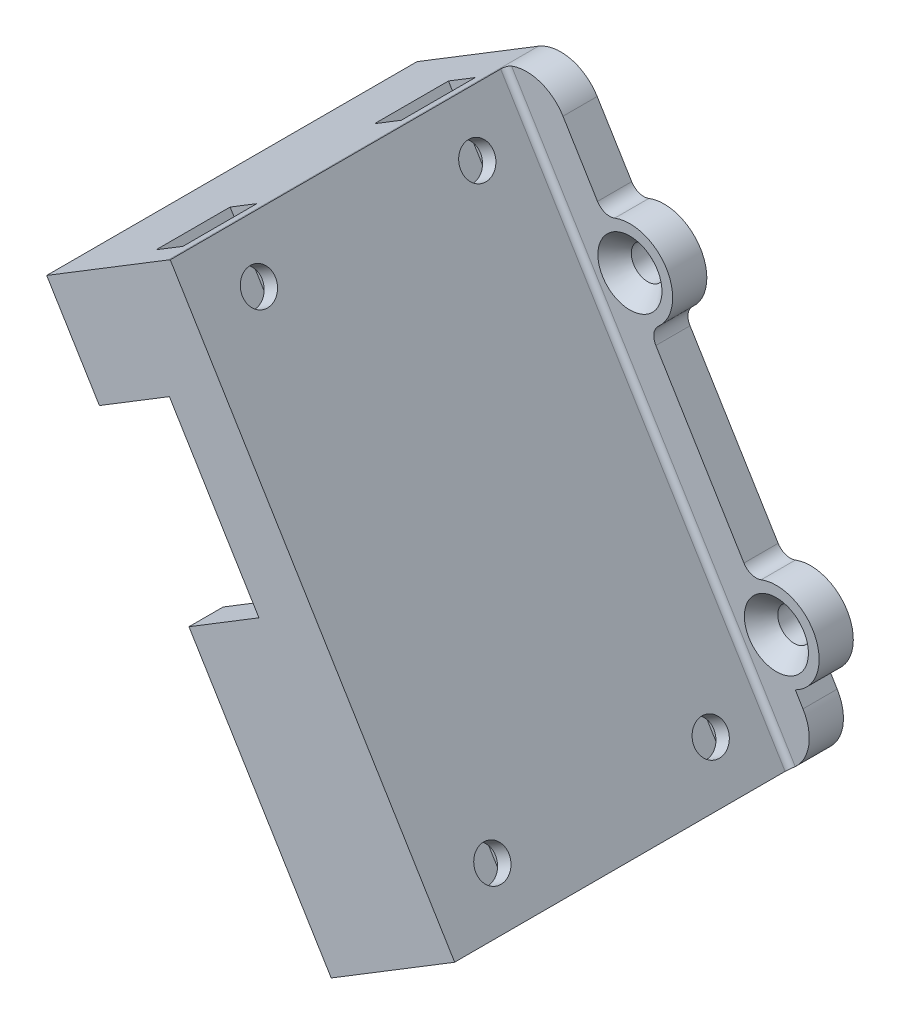
from build123d import *

# Parameters (mm, degrees)
BOSS_EXTRUDE1_DEPTH                               = 3.048
BOSS_EXTRUDE2_DEPTH                               = 29.971999999999998
BOSS_EXTRUDE3_DEPTH                               = 3.048
BOSS_EXTRUDE4_DEPTH                               = 3.048
SKETCH13_W                                        = 29.972
SKETCH13_H                                        = 48.7
BOSS_EXTRUDE5_DEPTH                               = 3.048
CSK_FOR_4_FLAT_HEAD_MACHINE_SCREW_100_D           = 2.9464
CSK_FOR_4_FLAT_HEAD_MACHINE_SCREW_100_CSINK_D     = 5.715
CSK_FOR_4_FLAT_HEAD_MACHINE_SCREW_100_CSINK_ANGLE = 100
CUT_EXTRUDE1_DEPTH                                = 1.397
CUT_EXTRUDE1_DEPTH_BACK                           = 1.397
SKETCH15_R                                        = 9.184035329670005
SKETCH15_R_2                                      = 8.124741076595411
SKETCH15_R_3                                      = 8.201451240556812
SKETCH15_R_4                                      = 5.810172256980604
BOSS_EXTRUDE6_DEPTH                               = 3.048
CSK_FOR_4_FLAT_HEAD_MACHINE_SCREW1_AT_2_COUNT     = 2
CSK_FOR_4_FLAT_HEAD_MACHINE_SCREW1_AT_2_PITCH     = 35.474094707842795
CSK_FOR_4_FLAT_HEAD_MACHINE_SCREW1_AT_3_COUNT     = 2
CSK_FOR_4_FLAT_HEAD_MACHINE_SCREW1_AT_3_PITCH     = 43.70753982500484
CSK_FOR_4_FLAT_HEAD_MACHINE_SCREW1_AT_4_COUNT     = 2
CSK_FOR_4_FLAT_HEAD_MACHINE_SCREW1_AT_4_PITCH     = 25.069264350610375
CUT_EXTRUDE2_DEPTH                                = 3.048
FILLET3_R                                         = 3.8099999999999996
FILLET4_R                                         = 1.27
SKETCH21_W                                        = 2.540000000000001
SKETCH21_H                                        = 33.02
CUT_EXTRUDE3_DEPTH                                = 77.47
FILLET5_R                                         = 0.508
FILLET6_R                                         = 0.508
SKETCH22_W                                        = 123.04970813102194
SKETCH22_H                                        = 134.7131875745612
CUT_EXTRUDE4_DEPTH                                = 77.47


with BuildPart() as part:
    # Sketch2 → Boss-Extrude1 (new body)
    with BuildSketch(Plane.XY):
        Polygon((-47.58059551455695, 48.12489153745831), (-22.21147896413696, 6.554494312375088), (5.701292889255674, 23.58878817682547), (-19.667823661164306, 65.1591854019087), align=None)
        Polygon((-38.85234269167306, 46.0124042215628), (-20.098991648241444, 15.282747135258976), (-3.0269599336282123, 25.701275492720985), (-21.78031097705982, 56.430932579024805), align=None, mode=Mode.SUBTRACT)
    extrude(amount=BOSS_EXTRUDE1_DEPTH)

    # Sketch3 → Boss-Extrude2 (add)
    with BuildSketch(Plane.XY.offset(3.048)):
        Polygon((2.4490708476218597, 21.604058524728963), (-22.920045702798127, 63.17445574981219), (-44.328373472923126, 50.10962118955482), (-18.95925692250314, 8.539223964471608), align=None)
        Polygon((-38.85234269167306, 46.0124042215628), (-20.098991648241444, 15.282747135258976), (-3.0269599336282087, 25.701275492720985), (-21.78031097705982, 56.430932579024805), align=None, mode=Mode.SUBTRACT)
    extrude(amount=BOSS_EXTRUDE2_DEPTH)

    # Sketch4 → Boss-Extrude3 (add)
    with BuildSketch(Plane.XY.offset(33.02)):
        Polygon((-38.85234269167306, 46.0124042215628), (-37.46131723814535, 43.733039051773666), (-20.389285523532113, 54.15156740923567), (-21.78031097705982, 56.430932579024805), align=None)
        Polygon((-29.47566716995725, 30.647575678410885), (-12.403635455344016, 41.0661040358729), (-3.0269599336282087, 25.701275492720985), (-20.098991648241444, 15.282747135258976), align=None)
    extrude(amount=-BOSS_EXTRUDE3_DEPTH)

    # Sketch12 → Boss-Extrude4 (add)
    with BuildSketch(Plane.XY.offset(3.048)):
        Polygon((2.4490708476218597, 21.604058524728963), (5.701292889255674, 23.58878817682547), (8.120429940678708, 25.065112049236276), (-17.248686609741274, 66.6355092743195), (-22.920045702798127, 63.17445574981219), align=None)
    extrude(amount=-BOSS_EXTRUDE4_DEPTH)

    # Sketch13 → Boss-Extrude5 (add)
    with BuildSketch(Plane(origin=(11.391019162328917, 6.95158362794815, 0), x_dir=(0, 0, -1), z_dir=(0.8536015857306615, 0.5209264178731006, 0))):
        with Locations((-18.034000000000002, 41.515472911157566)):
            Rectangle(SKETCH13_W, SKETCH13_H)
    extrude(amount=BOSS_EXTRUDE5_DEPTH)

    # CSK for #4 Flat Head Machine Screw (100)2 (through all)
    with Locations(Plane(origin=(-10.017308607796087, -6.113250932309213, 0), x_dir=(0, 0, 1), z_dir=(-0.8536015857306615, -0.5209264178731007, 0))):
        with Locations((27.397617355, 61.471448289), (7.925915452, 61.471448289), (7.925915452, 21.515515982), (27.397617355, 21.515515982)):
            CounterSinkHole(CSK_FOR_4_FLAT_HEAD_MACHINE_SCREW_100_D / 2, CSK_FOR_4_FLAT_HEAD_MACHINE_SCREW_100_CSINK_D / 2, counter_sink_angle=CSK_FOR_4_FLAT_HEAD_MACHINE_SCREW_100_CSINK_ANGLE)

    # Sketch14 → Cut-Extrude1 (cut, two sides: drawn at the far end of the back side and taken through both)
    with BuildSketch(Plane(origin=(11.607833965104508, 7.083898938087922, 0), x_dir=(0, 0, -1), z_dir=(0.8536015857306615, 0.5209264178731005, 0)).offset(-CUT_EXTRUDE1_DEPTH_BACK)):
        Polygon((-30.697174143874744, 19.61051598216394), (-30.697174143874744, 14.979833054183299), (-24.09806056703731, 14.979833054183299), (-24.09806056703731, 19.610515982163985), (-24.098060567037347, 23.42051598216399), (-27.39761735545604, 25.325515982163957), (-30.697174143874758, 23.420515982163952), align=None)
        Polygon((-27.39761735545604, 57.661448288693826), (-24.098060567037333, 59.56644828869383), (-24.098060567037336, 63.37644828869381), (-24.098060567037336, 70.99644828869384), (-30.69717414387474, 70.99644828869384), (-30.69717414387474, 63.37644828869381), (-30.69717414387474, 59.56644828869381), align=None)
        Polygon((-7.925915451689084, 57.661448288693826), (-4.626358663270381, 59.56644828869382), (-4.626358663270402, 63.37644828869381), (-4.626358663270402, 70.99644828869384), (-11.225472240107786, 70.99644828869384), (-11.225472240107786, 63.376448288693766), (-11.225472240107747, 59.566448288693785), align=None)
        Polygon((-7.925915451689081, 25.325515982163946), (-11.225472240107791, 23.42051598216395), (-11.225472240107791, 19.610515982163946), (-11.225472240107791, 14.979833054183299), (-4.626358663270366, 14.979833054183299), (-4.626358663270366, 19.610515982163953), (-4.6263586632703655, 23.420515982163952), align=None)
    extrude(amount=CUT_EXTRUDE1_DEPTH + CUT_EXTRUDE1_DEPTH_BACK, mode=Mode.SUBTRACT)

    # Sketch15 → Boss-Extrude6 (add)
    with BuildSketch(Plane(origin=(0, 0, 0), x_dir=(-1, 0, 0), z_dir=(0, 0, -1))):
        with Locations((9.758086495919196, 54.36124573948299)):
            Circle(SKETCH15_R)
        with Locations((39.927818301519274, 35.58488100974543)):
            Circle(SKETCH15_R_2)
        with Locations((25.610425726235285, 18.04643091882164)):
            Circle(SKETCH15_R_3)
        with Locations((-3.4576236647063787, 32.70568986323082)):
            Circle(SKETCH15_R_4)
    extrude(amount=-BOSS_EXTRUDE6_DEPTH)

    # Sketch19 → CSK for #4 Flat Head Machine Screw1 (revolve, cut)
    with BuildSketch(Plane(origin=(3.764373982237945, 32.86032278852424, 3.048), x_dir=(0, -1, 0), z_dir=(1, 0, 0))):
        Polygon((0, 0), (-7.5e-16, 3.0480000000000023), (1.4731999999999932, 3.0480000000000023), (1.4731999999999934, 1.59245498611605), (2.857499999999999, -1.73e-15), align=None)
    csk_for_4_flat_head_machine_screw1 = revolve(axis=Axis((3.764373982237945, 32.86032278852424, 9.39799999999999), (0, 0, -1)), mode=Mode.SUBTRACT)

    # CSK for #4 Flat Head Machine Screw1 at 2: CSK for #4 Flat Head Machine Screw1 ×2
    with Locations(*[Vector(-0.8506492202713736, -0.5257336816789507, 0) * (i * CSK_FOR_4_FLAT_HEAD_MACHINE_SCREW1_AT_2_PITCH) for i in range(1, CSK_FOR_4_FLAT_HEAD_MACHINE_SCREW1_AT_2_COUNT)]):
        add(csk_for_4_flat_head_machine_screw1, mode=Mode.SUBTRACT)

    # CSK for #4 Flat Head Machine Screw1 at 3: CSK for #4 Flat Head Machine Screw1 ×2
    with Locations(*[Vector(-0.997755305773639, 0.06696528802709796, 0) * (i * CSK_FOR_4_FLAT_HEAD_MACHINE_SCREW1_AT_3_PITCH) for i in range(1, CSK_FOR_4_FLAT_HEAD_MACHINE_SCREW1_AT_3_COUNT)]):
        add(csk_for_4_flat_head_machine_screw1, mode=Mode.SUBTRACT)

    # CSK for #4 Flat Head Machine Screw1 at 4: CSK for #4 Flat Head Machine Screw1 ×2
    with Locations(*[Vector(-0.5210117203175807, 0.8535495224600124, 0) * (i * CSK_FOR_4_FLAT_HEAD_MACHINE_SCREW1_AT_4_PITCH) for i in range(1, CSK_FOR_4_FLAT_HEAD_MACHINE_SCREW1_AT_4_COUNT)]):
        add(csk_for_4_flat_head_machine_screw1, mode=Mode.SUBTRACT)

    # Sketch20 → Cut-Extrude2 (cut)
    with BuildSketch(Plane(origin=(0, 0, 0), x_dir=(-1, 0, 0), z_dir=(0, 0, -1))):
        with BuildLine():
            Line((14.542293121824187, 62.20075286029573), (11.563953125478477, 57.32037886408755))
            ThreePointArc((11.563953125478477, 57.32037886408755), (6.044784522535942, 56.24291105550805), (7.610320649443919, 50.84186897257834))
            Line((7.610320649443919, 50.84186897257834), (-1.4954062126549716, 35.92102291440944))
            ThreePointArc((-1.4954062126549716, 35.92102291440944), (-7.016596023871767, 34.845052440620755), (-5.448804035753348, 29.442897530407524))
            Line((-5.448804035753348, 29.442897530407524), (-6.484295885760952, 27.746117611303884))
            Line((-6.484295885760952, 27.746117611303884), (-6.762670750549963, 27.28996638176623))
            Line((-6.762670750549963, 27.28996638176623), (-14.061950278269341, 31.74448896114331))
            Line((-14.061950278269341, 31.74448896114331), (8.559037851416688, 68.81174198534737))
            Line((8.559037851416688, 68.81174198534737), (14.542293121824187, 65.16034795406075))
            Line((14.542293121824187, 65.16034795406075), (14.542293121824187, 62.20075286029573))
        make_face()
        Polygon((21.78031097705982, 56.430932579024805), (38.85234269167306, 46.0124042215628), (20.098991648241444, 15.282747135258976), (3.0269599336282123, 25.701275492720985), align=None)
        with BuildLine():
            Line((22.21147896413696, 6.554494312375088), (24.781951964671258, 10.766528400207497))
            ThreePointArc((24.781951964671258, 10.766528400207497), (29.66385906245521, 12.225666721445755), (28.72915433514684, 17.23450177808784))
            Line((28.72915433514684, 17.23450177808784), (38.012718373529104, 32.44675577885475))
            ThreePointArc((38.012718373529104, 32.44675577885475), (43.097277822107074, 33.802481129765034), (41.97793801322115, 38.944252653808825))
            Line((41.97793801322115, 38.944252653808825), (47.58059551455695, 48.12489153745831))
            Line((47.58059551455695, 48.12489153745831), (51.80171473929435, 35.787210781861546))
            Line((51.80171473929435, 35.787210781861546), (47.57680035710003, 5.227667032097241))
            Line((47.57680035710003, 5.227667032097241), (22.21147896413696, 6.554494312375088))
        make_face()
    extrude(amount=-CUT_EXTRUDE2_DEPTH, mode=Mode.SUBTRACT)


with BuildPart() as body_2:
    # of the pieces the cut leaves, the one that is kept (cut_extrude2_keep)
    add(part.part.solids().sort_by_distance((-47.580595515, 48.124891537, 0))[0])

    # Fillet3
    fillet3_edges = [body_2.edges().sort_by_distance(p)[0] for p in [
        (-17.248686609741274, 66.6355092743195, 1.524),
        (-47.58059551455695, 48.12489153745831, 1.524),
        (-22.21147896413696, 6.554494312375088, 1.524),
        (8.120429940678708, 25.065112049236276, 1.524),
    ]]
    fillet(fillet3_edges, radius=FILLET3_R)

    # Fillet4
    fillet4_edges = [body_2.edges().sort_by_distance(p)[0] for p in [
        (-24.781951964671258, 10.766528400207495, 1.524),
        (-28.72915433514684, 17.23450177808784, 1.524),
        (-38.0127183735291, 32.44675577885475, 1.524),
        (-41.97793801322115, 38.94425265380882, 1.524),
        (-11.563953125478475, 57.320378864087544, 1.524),
        (-7.610320649443917, 50.84186897257834, 1.524),
        (1.4954062126549714, 35.92102291440944, 1.524),
    ]]
    fillet(fillet4_edges, radius=FILLET4_R)

    # Sketch21 → Cut-Extrude3 (cut)
    with BuildSketch(Plane(origin=(-8.941948314707059, 14.652474896780824, 0), x_dir=(0.8536015857306616, 0.5209264178731006, 0), z_dir=(0.5209264178731005, -0.8536015857306615, 0))):
        with Locations((2.2216732427396275, 16.51)):
            Rectangle(SKETCH21_W, SKETCH21_H)
    extrude(amount=-CUT_EXTRUDE3_DEPTH, mode=Mode.SUBTRACT)


with BuildPart() as cut_extrude3_piece_1:
    # of the separate pieces the step leaves, piece 1, a body of its own (cut_extrude3_pieces)
    add(body_2.part.solids().sort_by_distance((-12.188709065, 58.344117807, 0))[0])

    # Fillet6
    fillet6_edges = [cut_extrude3_piece_1.edges().sort_by_distance(p)[0] for p in [
        (-7.633709794281099, 43.97704085894782, 3.048),
    ]]
    fillet(fillet6_edges, radius=FILLET6_R)


with BuildPart() as cut_extrude3_piece_2:
    # of the separate pieces the step leaves, piece 2, a body of its own (cut_extrude3_pieces)
    add(body_2.part.solids().sort_by_distance((-42.532157132, 39.852408399, 0))[0])

    # Fillet5
    fillet5_edges = [cut_extrude3_piece_2.edges().sort_by_distance(p)[0] for p in [
        (-31.64381519771313, 29.324422577013216, 3.048),
    ]]
    fillet(fillet5_edges, radius=FILLET5_R)

    # Sketch22 → Cut-Extrude4 (cut)
    with BuildSketch(Plane(origin=(2.067982642978631, 1.2620252919381492, 0), x_dir=(0, 0, -1), z_dir=(0.8536015857306616, 0.5209264178731006, 0))):
        with Locations((-42.687564536567926, 74.45417523171726)):
            Rectangle(SKETCH22_W, SKETCH22_H)
    extrude(amount=-CUT_EXTRUDE4_DEPTH, mode=Mode.SUBTRACT)


solid = cut_extrude3_piece_1.part
